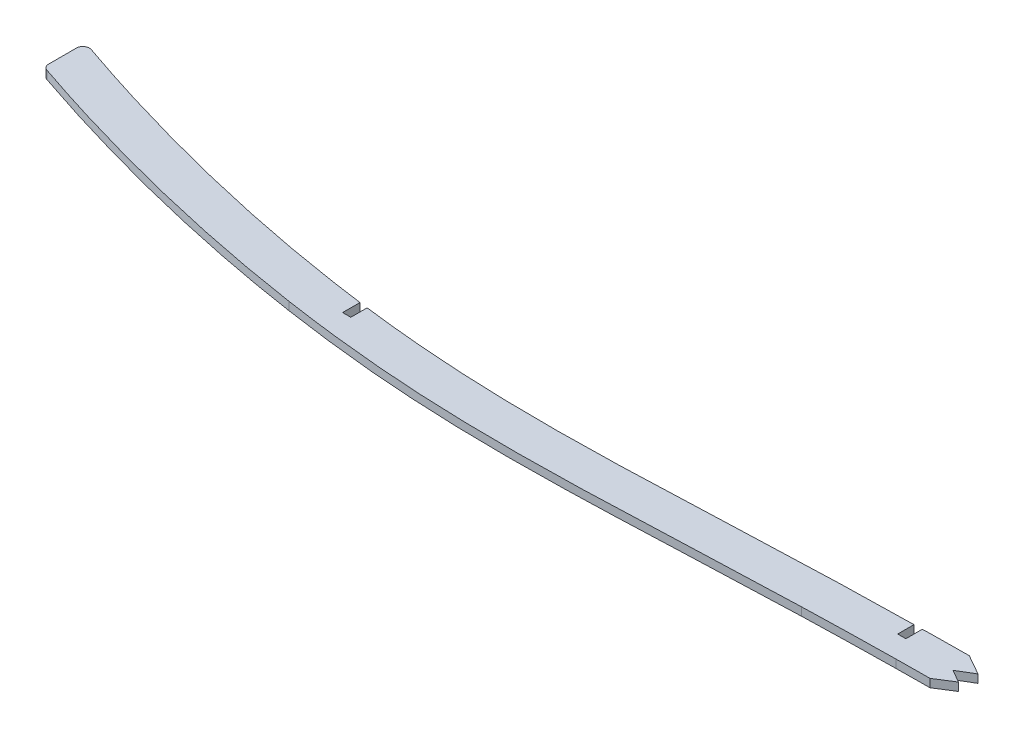
from build123d import *

# Parameters (mm, degrees)
BOSS_EXTRUDE1_START = -1.5875
BOSS_EXTRUDE1_DEPTH = 3.175
FILLET1_R           = 2.54
CUT_EXTRUDE1_DEPTH  = 2673.169061301
CUT_EXTRUDE2_DEPTH  = 7.62


with BuildPart() as part:
    # Boss-Extrude1: read off the stored shape, not the designer's step
    # Boss-Extrude1 outline → Boss-Extrude1 (new body)
    with BuildSketch(Plane(origin=(0, 0, 0), x_dir=(1, 0, 0), z_dir=(0, 1, 0)).offset(BOSS_EXTRUDE1_START)):
        with BuildLine():
            Line((463.481517793, -98.977696854), (427.350904327, -99.755686873))
            add(Edge.make_bspline(
                [(427.350904327, -99.755686873), (418.862421221, -100.008124614), (401.866088129, -100.608803357), (368.059852939, -102.023512545), (334.562278265, -103.305731984), (301.483653152, -103.218702016), (276.797777307, -102.194932027), (252.27640901, -100.070407207), (235.925248591, -97.923437961), (227.785190572, -96.692259941)],
                knots=[0, 0, 0, 0, 0.125038463, 0.250076927, 0.500153853, 0.625192317, 0.75023078, 0.875269244, 1.000307707, 1.000307707, 1.000307707, 1.000307707], degree=3))
            add(Edge.make_bspline(
                [(227.785190572, -96.692259941), (213.110880299, -94.472780138), (183.93469275, -89.006619914), (142.715027592, -78.571723038), (114.603726318, -69.716981467), (100.814391379, -64.915814298), (99.06, -64.297537836)],
                knots=[0.00014922, 0.00014922, 0.00014922, 0.00014922, 0.250111912, 0.500074608, 0.714106561, 0.745351898, 0.745351898, 0.745351898, 0.745351898], degree=3))
            Line((99.06, -64.297537836), (99.06, -80.435972635))
            add(Edge.make_bspline(
                [(99.06, -80.435972635), (104.274196502, -82.231853296), (109.507322686, -83.96997604), (121.992341978, -87.962504163), (129.263501237, -90.165200397), (143.866524863, -94.34435671), (151.19809916, -96.320939574), (165.92167747, -100.046969279), (173.315840114, -101.797066047), (195.561746525, -106.69261065), (210.48308935, -109.488660696), (225.506072884, -111.760877083)],
                knots=[0.284226648, 0.284226648, 0.284226648, 0.284226648, 0.375, 0.375, 0.5, 0.5, 0.625, 0.625, 0.75, 0.75, 1, 1, 1, 1], degree=3))
            add(Edge.make_bspline(
                [(225.506072884, -111.760877083), (233.858386736, -113.024158647), (242.227594967, -114.122194791), (259.003461577, -115.951963882), (267.410478961, -116.68018536), (280.049991072, -117.489002615), (284.26917928, -117.711854611), (292.706766588, -118.068182791), (296.925968196, -118.20175247), (309.584686499, -118.480744306), (318.025325165, -118.503521129), (334.908743785, -118.315005384), (343.352388312, -118.104618683), (360.233144502, -117.562255384), (368.671341038, -117.230934371), (385.546900881, -116.545322545), (393.984302215, -116.19208005), (410.861092672, -115.540392758), (419.300477696, -115.241834951), (427.741586833, -114.990806057)],
                knots=[0, 0, 0, 0, 0.125, 0.125, 0.25, 0.25, 0.3125, 0.3125, 0.375, 0.375, 0.5, 0.5, 0.625, 0.625, 0.75, 0.75, 0.875, 0.875, 1, 1, 1, 1], degree=3))
            add(Edge.make_bspline(
                [(427.741586833, -114.990806057), (433.729413487, -114.812652177), (439.717847223, -114.655194797), (451.695979443, -114.3953683), (457.68553345, -114.292726521), (463.675525417, -114.216461911)],
                knots=[0, 0, 0, 0, 0.5, 0.5, 1, 1, 1, 1], degree=3))
            add(Edge.make_bspline(
                [(463.675525417, -114.216461911), (470.785382475, -114.125939241), (477.895647472, -114.072781143), (492.116266715, -114.019175519), (499.226625181, -114.01735353), (520.557752109, -114.03824298), (534.778415195, -114.088228036), (548.999079931, -114.136269744)],
                knots=[0, 0, 0, 0, 0.25, 0.25, 0.5, 0.5, 1, 1, 1, 1], degree=3))
            add(Edge.make_bspline(
                [(548.999079931, -114.136269744), (560.220276672, -114.174178365), (571.441476667, -114.211622104), (593.883924596, -114.268599335), (605.105170909, -114.288269821), (616.326429146, -114.296606155)],
                knots=[0, 0, 0, 0, 0.5, 0.5, 1, 1, 1, 1], degree=3))
            add(Edge.make_bspline(
                [(616.326429146, -114.296606155), (632.04621738, -114.30828436), (647.765968153, -114.296774394), (679.205420393, -114.24323397), (694.925123067, -114.201950933), (726.364532125, -114.121681347), (742.0842434, -114.083543006), (773.523671883, -114.034083389), (789.243390213, -114.023396076), (820.682831325, -114.017303041), (836.402553623, -114.020240225), (867.841997843, -114.024821457), (883.561720422, -114.028722489), (915.001165911, -114.037662965), (930.720888645, -114.04209584), (962.160332218, -114.044456393), (977.880053631, -114.042025852), (1025.039240625, -114.026352661), (1056.478726331, -114.00108124), (1103.637743706, -114.076141518), (1119.357382012, -114.119430037), (1150.796589716, -114.242868384), (1166.516159417, -114.322855573), (1213.674806337, -114.596079867), (1245.113813814, -114.824335418), (1307.992068737, -115.160349225), (1339.431327838, -115.26277592), (1386.59071759, -115.166774968), (1402.310597754, -115.093136109), (1433.750539713, -114.855373393), (1449.469718126, -114.691491377), (1480.905247202, -114.282993413), (1496.621842734, -114.038617844), (1528.053234249, -113.488096449), (1543.768039181, -113.182257797), (1590.910126723, -112.184857954), (1622.335087164, -111.41358735), (1685.180622448, -109.720508747), (1716.601206009, -108.799000008), (1779.439542968, -106.858836008), (1810.857304519, -105.840460628), (1873.691027846, -103.741931839), (1905.106997705, -102.662055888), (1967.937400908, -100.449562537), (1999.351842263, -99.317220068), (2062.178442698, -96.974195187), (2093.59060921, -95.763767813), (2125.000640174, -94.480036945)],
                knots=[0, 0, 0, 0, 0.03125, 0.03125, 0.0625, 0.0625, 0.09375, 0.09375, 0.125, 0.125, 0.15625, 0.15625, 0.1875, 0.1875, 0.21875, 0.21875, 0.25, 0.25, 0.3125, 0.3125, 0.34375, 0.34375, 0.375, 0.375, 0.4375, 0.4375, 0.5, 0.5, 0.53125, 0.53125, 0.5625, 0.5625, 0.59375, 0.59375, 0.625, 0.625, 0.6875, 0.6875, 0.75, 0.75, 0.8125, 0.8125, 0.875, 0.875, 0.9375, 0.9375, 1, 1, 1, 1], degree=3))
            add(Edge.make_bspline(
                [(2125.000640174, -94.480036945), (2149.043512053, -93.497408198), (2173.084656935, -92.471430319), (2221.160511116, -90.282545134), (2245.195534081, -89.119655168), (2281.239757247, -87.221357571), (2293.253026932, -86.562238774), (2317.276292873, -85.185372522), (2329.286674963, -84.469587706), (2353.300431949, -82.936097691), (2365.303298861, -82.116745479), (2389.295700221, -80.303201383), (2401.285131688, -79.307659014), (2425.248015539, -77.107027292), (2437.219395044, -75.902126229), (2461.135042925, -73.272860721), (2473.08021873, -71.848649744), (2496.945889729, -68.786405154), (2508.867210067, -67.148439822), (2532.676751502, -63.675594501), (2544.566194734, -61.840767768), (2568.317359069, -57.993135306), (2580.179611266, -55.980432347), (2603.876576666, -51.794563265), (2615.710909808, -49.621694996), (2639.350360155, -45.125086501), (2651.156219503, -42.80151333), (2665.144217076, -39.951429742), (2667.342402296, -39.500717262), (2669.54, -39.047177022)],
                knots=[0, 0, 0, 0, 0.125, 0.125, 0.25, 0.25, 0.3125, 0.3125, 0.375, 0.375, 0.4375, 0.4375, 0.5, 0.5, 0.5625, 0.5625, 0.625, 0.625, 0.6875, 0.6875, 0.75, 0.75, 0.8125, 0.8125, 0.875, 0.875, 0.9375, 0.9375, 0.949156536, 0.949156536, 0.949156536, 0.949156536], degree=3))
            Line((2669.54, -39.047177022), (2669.54, -23.48404926))
            add(Edge.make_bspline(
                [(2124.378303089, -79.252749053), (2148.397511932, -78.271087411), (2196.441425914, -76.220230463), (2256.436326715, -73.319302978), (2304.39682767, -70.686853716), (2340.342003366, -68.544044046), (2376.169099534, -66.099901772), (2423.792254479, -62.148433447), (2483.117302519, -55.632651017), (2554.044456911, -45.226530814), (2611.906127764, -34.972755606), (2648.229540612, -27.845365737), (2663.16372025, -24.802445768), (2667.415112986, -23.925290392), (2669.54, -23.48404926)],
                knots=[0, 0, 0, 0, 0.125, 0.25, 0.3125, 0.375, 0.4375, 0.5, 0.625, 0.75, 0.875, 0.931953524, 0.943294604, 0.954635683, 0.954635683, 0.954635683, 0.954635683], degree=3))
            add(Edge.make_bspline(
                [(616.337750913, -99.056610361), (647.760496601, -99.079954266), (694.870680343, -98.960929783), (757.779786959, -98.804063039), (820.690458186, -98.765348433), (899.289299877, -98.796796583), (993.586772551, -98.812914928), (1087.931915928, -98.732357487), (1182.339530793, -99.124499499), (1276.653980681, -99.814761199), (1370.850831485, -100.131815232), (1464.98207814, -99.410819046), (1590.549452681, -97.151170263), (1747.540081264, -92.783387293), (1904.580584785, -87.479552507), (2030.204554218, -82.955875899), (2092.987058489, -80.535712121), (2124.378303089, -79.252749053)],
                knots=[0, 0, 0, 0, 0.0625, 0.09375, 0.125, 0.1875, 0.25, 0.3125, 0.375, 0.4375, 0.5, 0.5625, 0.625, 0.75, 0.875, 0.9375, 1, 1, 1, 1], degree=3))
            add(Edge.make_bspline(
                [(549.050564999, -98.89635671), (554.659992113, -98.915307063), (565.880376817, -98.952985098), (582.701799226, -99.002380959), (599.520778593, -99.038450073), (610.731968981, -99.052445795), (616.337750913, -99.056610361)],
                knots=[0, 0, 0, 0, 0.25, 0.5, 0.75, 1, 1, 1, 1], degree=3))
            add(Edge.make_bspline(
                [(463.481517793, -98.977696854), (470.636830327, -98.886595426), (484.965179859, -98.780290974), (506.357680509, -98.775608099), (527.715649674, -98.823220556), (541.937533288, -98.872326737), (549.050564999, -98.89635671)],
                knots=[0, 0, 0, 0, 0.25, 0.5, 0.75, 1, 1, 1, 1], degree=3))
        make_face()
    extrude(amount=BOSS_EXTRUDE1_DEPTH)

    # Fillet1
    fillet1_edges = [part.edges().sort_by_distance(p)[0] for p in [
        (2669.54, 0, 39.047177022),
        (2669.54, 0, 23.48404926),
        (99.06, 0, 64.297537836),
        (99.06, 0, 80.435972635),
    ]]
    fillet(fillet1_edges, radius=FILLET1_R)

    # Sketch2 → Cut-Extrude1 (cut, through all)
    with BuildSketch(Plane(origin=(0, 1.5875, 0), x_dir=(1, 0, 0), z_dir=(0, 1, 0))):
        Polygon((458.7875, -99.078771778), (455.6125, -99.147138132), (455.6125, -105.462954955), (458.7875, -105.462954955), align=None)
        with BuildLine():
            Line((2487.6125, -54.614044682), (2487.6125, -60.756097975))
            Line((2487.6125, -60.756097975), (2490.7875, -60.756097975))
            Line((2490.7875, -60.756097975), (2490.7875, -54.196862137))
            add(Edge.make_bspline(
                [(2490.7875, -54.196862137), (2489.72925344, -54.336769839), (2488.670920227, -54.475833001), (2487.6125, -54.614044682)],
                knots=[0.635778938, 0.635778938, 0.635778938, 0.635778938, 0.641365892, 0.641365892, 0.641365892, 0.641365892], degree=3))
        make_face()
        with BuildLine():
            Line((2309.8125, -70.346479383), (2309.8125, -75.33420721))
            Line((2309.8125, -75.33420721), (2312.9875, -75.33420721))
            Line((2312.9875, -75.33420721), (2312.9875, -70.161551132))
            add(Edge.make_bspline(
                [(2312.9875, -70.161551132), (2311.929224732, -70.223449083), (2310.870887845, -70.285086749), (2309.8125, -70.346479383)],
                knots=[0.324680898, 0.324680898, 0.324680898, 0.324680898, 0.330200553, 0.330200553, 0.330200553, 0.330200553], degree=3))
        make_face()
        with BuildLine():
            Line((2132.0125, -78.939241639), (2132.0125, -85.223663793))
            Line((2132.0125, -85.223663793), (2135.1875, -85.223663793))
            Line((2135.1875, -85.223663793), (2135.1875, -78.807949765))
            add(Edge.make_bspline(
                [(2135.1875, -78.807949765), (2134.129165205, -78.851804918), (2133.070831452, -78.8955682), (2132.0125, -78.939241639)],
                knots=[0.015996912, 0.015996912, 0.015996912, 0.015996912, 0.021504552, 0.021504552, 0.021504552, 0.021504552], degree=3))
        make_face()
        with BuildLine():
            Line((2005.0125, -83.846915394), (2005.0125, -90.138723071))
            Line((2005.0125, -90.138723071), (2008.1875, -90.138723071))
            Line((2008.1875, -90.138723071), (2008.1875, -83.730469865))
            add(Edge.make_bspline(
                [(2008.1875, -83.730469865), (2007.129173184, -83.769325496), (2006.070839765, -83.808140465), (2005.0125, -83.846915394)],
                knots=[0.921843858, 0.921843858, 0.921843858, 0.921843858, 0.923950286, 0.923950286, 0.923950286, 0.923950286], degree=3))
        make_face()
        with BuildLine():
            Line((1827.2125, -90.049540749), (1827.2125, -96.347044402))
            Line((1827.2125, -96.347044402), (1830.3875, -96.347044402))
            Line((1830.3875, -96.347044402), (1830.3875, -89.944485596))
            add(Edge.make_bspline(
                [(1830.3875, -89.944485596), (1829.32916541, -89.979545586), (1828.270832057, -90.01456412), (1827.2125, -90.049540749)],
                knots=[0.803899516, 0.803899516, 0.803899516, 0.803899516, 0.806005654, 0.806005654, 0.806005654, 0.806005654], degree=3))
        make_face()
        with BuildLine():
            Line((1649.4125, -95.434799369), (1649.4125, -101.74230383))
            Line((1649.4125, -101.74230383), (1652.5875, -101.74230383))
            Line((1652.5875, -101.74230383), (1652.5875, -95.349679657))
            add(Edge.make_bspline(
                [(1652.5875, -95.349679657), (1651.529164065, -95.378138541), (1650.470830734, -95.406512136), (1649.4125, -95.434799369)],
                knots=[0.68594206, 0.68594206, 0.68594206, 0.68594206, 0.688048735, 0.688048735, 0.688048735, 0.688048735], degree=3))
        make_face()
        with BuildLine():
            Line((1471.6125, -99.161176944), (1471.6125, -105.489537584))
            Line((1471.6125, -105.489537584), (1474.7875, -105.489537584))
            Line((1474.7875, -105.489537584), (1474.7875, -99.117630423))
            add(Edge.make_bspline(
                [(1474.7875, -99.117630423), (1473.729158832, -99.132324193), (1472.670825431, -99.146840459), (1471.6125, -99.161176944)],
                knots=[0.567950133, 0.567950133, 0.567950133, 0.567950133, 0.570057648, 0.570057648, 0.570057648, 0.570057648], degree=3))
        make_face()
        with BuildLine():
            Line((1293.8125, -99.83749143), (1293.8125, -106.18749143))
            Line((1293.8125, -106.18749143), (1296.9875, -106.18749143))
            Line((1296.9875, -106.18749143), (1296.9875, -99.851512251))
            add(Edge.make_bspline(
                [(1296.9875, -99.851512251), (1295.929186903, -99.846935009), (1294.87085368, -99.842259989), (1293.8125, -99.83749143)],
                knots=[0.449944799, 0.449944799, 0.449944799, 0.449944799, 0.452050611, 0.452050611, 0.452050611, 0.452050611], degree=3))
        make_face()
        with BuildLine():
            Line((1116.0125, -98.877614065), (1116.0125, -105.232528283))
            Line((1116.0125, -105.232528283), (1119.1875, -105.232528283))
            Line((1119.1875, -105.232528283), (1119.1875, -98.887560686))
            add(Edge.make_bspline(
                [(1119.1875, -98.887560686), (1118.129164273, -98.884166533), (1117.07083061, -98.880850623), (1116.0125, -98.877614065)],
                knots=[0.332139046, 0.332139046, 0.332139046, 0.332139046, 0.334241398, 0.334241398, 0.334241398, 0.334241398], degree=3))
        make_face()
        with BuildLine():
            Line((823.9125, -98.777475421), (823.9125, -105.127430466))
            Line((823.9125, -105.127430466), (827.0875, -105.127430466))
            Line((827.0875, -105.127430466), (827.0875, -98.777412477))
            add(Edge.make_bspline(
                [(827.0875, -98.777412477), (826.029176824, -98.777415639), (824.97084358, -98.777436304), (823.9125, -98.777475421)],
                knots=[0.138607063, 0.138607063, 0.138607063, 0.138607063, 0.140710549, 0.140710549, 0.140710549, 0.140710549], degree=3))
        make_face()
        with BuildLine():
            Line((608.0125, -99.04838129), (608.0125, -105.400261054))
            Line((608.0125, -105.400261054), (611.1875, -105.400261054))
            Line((611.1875, -105.400261054), (611.1875, -99.051996207))
            add(Edge.make_bspline(
                [(611.1875, -99.051996207), (610.129167277, -99.050888003), (609.070835183, -99.049682312), (608.0125, -99.04838129)],
                knots=[0.899838455, 0.899838455, 0.899838455, 0.899838455, 0.947037247, 0.947037247, 0.947037247, 0.947037247], degree=3))
        make_face()
        with BuildLine():
            Line((242.8875, -105.135594032), (242.8875, -98.785594032))
            add(Edge.make_bspline(
                [(242.8875, -98.785594032), (241.828921211, -98.652522157), (240.770561473, -98.516544317), (239.7125, -98.37771481)],
                knots=[0.923143429, 0.923143429, 0.923143429, 0.923143429, 0.939344476, 0.939344476, 0.939344476, 0.939344476], degree=3))
            Line((239.7125, -98.37771481), (239.7125, -105.135594032))
            Line((239.7125, -105.135594032), (242.8875, -105.135594032))
        make_face()
    extrude(amount=-CUT_EXTRUDE1_DEPTH, mode=Mode.SUBTRACT)

    # Sketch3 → Cut-Extrude2 (cut)
    with BuildSketch(Plane(origin=(0, 1.5875, 0), x_dir=(1, 0, 0), z_dir=(0, 1, 0))):
        Polygon((476.797041743, -98.849097611), (476.797041743, 40.917218584), (2972.510848893, 148.094696625), (2617.465456777, -477.099950745), (476.797041743, -122.958691564), (476.797041743, -114.089259739), (483.581134609, -109.807059007), (478.528826473, -106.937874617), (484.630988809, -103.297962968), align=None)
    extrude(amount=-CUT_EXTRUDE2_DEPTH, mode=Mode.SUBTRACT)


solid = part.part
